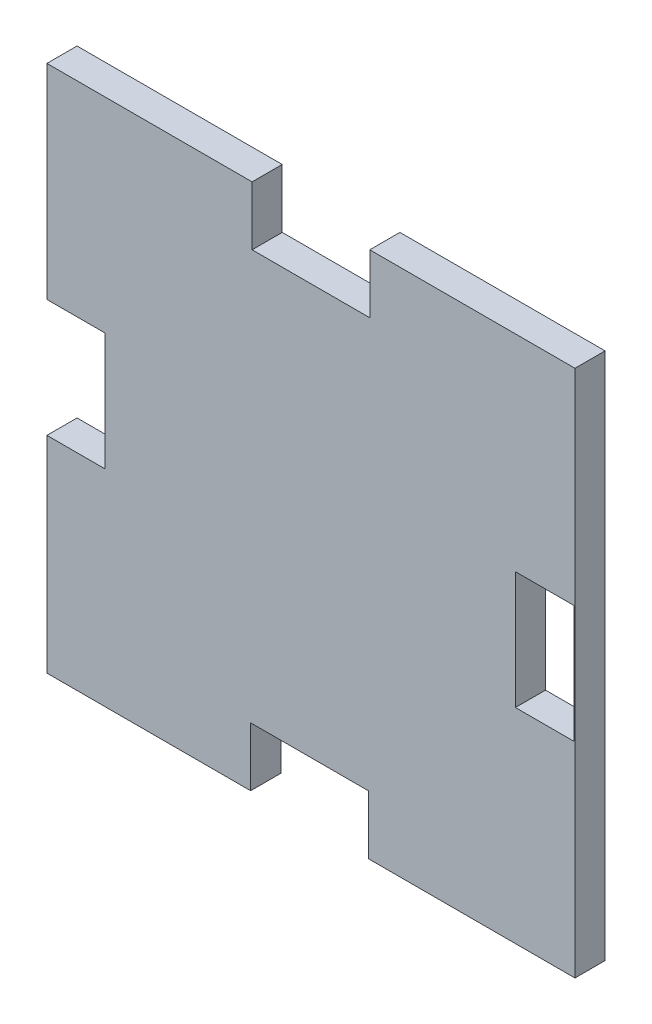
from build123d import *

# Parameters (mm, degrees)
BOSS_EXTRUDE1_DEPTH = 5.12
SKETCH2_W           = 10
SKETCH2_H           = 20
SKETCH2_W_2         = 20
SKETCH2_H_2         = 10
CUT_EXTRUDE1_DEPTH  = 130.474906159


with BuildPart() as part:
    # Sketch1 → Boss-Extrude1 (new body)
    with BuildSketch(Plane.XY):
        Polygon((1.120381921, 62.157647161), (1.120381921, 32.237647161), (1.120381921, 2.317647161), (31.040381921, 2.317647161), (60.960381921, 2.317647161), (90.880381921, 2.317647161), (90.880381921, 32.237647161), (90.880381921, 62.157647161), (90.880381921, 92.077647161), (60.960381921, 92.077647161), (31.040381921, 92.077647161), (1.120381921, 92.077647161), align=None)
    extrude(amount=BOSS_EXTRUDE1_DEPTH)

    # Sketch2 → Cut-Extrude1 (cut, through all)
    with BuildSketch(Plane.XY.offset(5.12)):
        with Locations((5.994820768, 47.323208314)):
            Rectangle(SKETCH2_W, SKETCH2_H)
        with Locations((46.000381921, 87.077647161)):
            Rectangle(SKETCH2_W_2, SKETCH2_H_2)
        with Locations((85.754820768, 47.072086008)):
            Rectangle(SKETCH2_W, SKETCH2_H)
        with Locations((45.749259615, 7.317647161)):
            Rectangle(SKETCH2_W_2, SKETCH2_H_2)
    extrude(amount=-CUT_EXTRUDE1_DEPTH, mode=Mode.SUBTRACT)


solid = part.part
